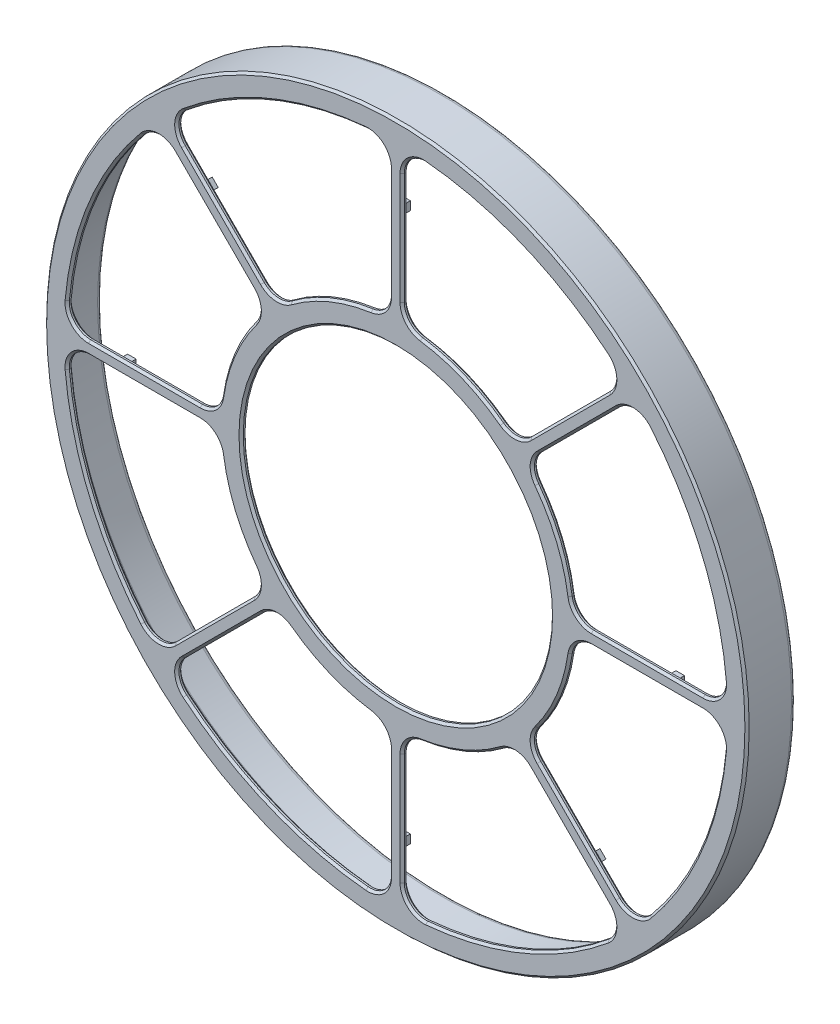
from build123d import *

# Parameters (mm, degrees)
SKETCH1_R           = 104.14
SKETCH1_R_2         = 45.847
BOSS_EXTRUDE5_DEPTH = 1.778
FILLET1_R           = 6.35
BOSS_EXTRUDE6_START = 12.7
SKETCH2_R           = 104.14
SKETCH2_R_2         = 101.6
BOSS_EXTRUDE6_DEPTH = 12.7
FILLET2_R           = 2.54
CHAMFER2_SIZE       = 0.635
SKETCH4_W           = 2.54
SKETCH4_H           = 2.54
BOSS_EXTRUDE7_DEPTH = 1.27
FILLET3_R           = 1.27


with BuildPart() as part:
    # Sketch1 → Boss-Extrude5 (new body)
    with BuildSketch(Plane.XY):
        Circle(SKETCH1_R)
        with BuildLine():
            ThreePointArc((-1.905, 52.162225643), (-19.974927119, 48.223739958), (-35.537225056, 38.231301892))
            Line((-35.537225056, 38.231301892), (-67.787811965, 70.481888801))
            ThreePointArc((-67.787811965, 70.481888801), (-37.422612851, 90.346179484), (-1.905, 97.771443044))
            Line((-1.905, 97.771443044), (-1.905, 52.162225643))
        make_face(mode=Mode.SUBTRACT)
        with BuildLine():
            Line((-70.481888801, 67.787811965), (-38.231301892, 35.537225056))
            ThreePointArc((-38.231301892, 35.537225056), (-48.223739958, 19.974927119), (-52.162225643, 1.905))
            Line((-52.162225643, 1.905), (-97.771443044, 1.905))
            ThreePointArc((-97.771443044, 1.905), (-90.346179484, 37.422612851), (-70.481888801, 67.787811965))
        make_face(mode=Mode.SUBTRACT)
        with BuildLine():
            Line((1.905, 52.162225643), (1.905, 97.771443044))
            ThreePointArc((1.905, 97.771443044), (37.422612851, 90.346179484), (67.787811965, 70.481888801))
            Line((67.787811965, 70.481888801), (35.537225056, 38.231301892))
            ThreePointArc((35.537225056, 38.231301892), (19.974927119, 48.223739958), (1.905, 52.162225643))
        make_face(mode=Mode.SUBTRACT)
        with BuildLine():
            Line((-97.771443044, -1.905), (-52.162225643, -1.905))
            ThreePointArc((-52.162225643, -1.905), (-48.223739958, -19.974927119), (-38.231301892, -35.537225056))
            Line((-38.231301892, -35.537225056), (-70.481888801, -67.787811965))
            ThreePointArc((-70.481888801, -67.787811965), (-90.346179484, -37.422612851), (-97.771443044, -1.905))
        make_face(mode=Mode.SUBTRACT)
        with BuildLine():
            Line((38.231301892, 35.537225056), (70.481888801, 67.787811965))
            ThreePointArc((70.481888801, 67.787811965), (90.346179484, 37.422612851), (97.771443044, 1.905))
            Line((97.771443044, 1.905), (52.162225643, 1.905))
            ThreePointArc((52.162225643, 1.905), (48.223739958, 19.974927119), (38.231301892, 35.537225056))
        make_face(mode=Mode.SUBTRACT)
        with BuildLine():
            Line((-67.787811965, -70.481888801), (-35.537225056, -38.231301892))
            ThreePointArc((-35.537225056, -38.231301892), (-19.974927119, -48.223739958), (-1.905, -52.162225643))
            Line((-1.905, -52.162225643), (-1.905, -97.771443044))
            ThreePointArc((-1.905, -97.771443044), (-37.422612851, -90.346179484), (-67.787811965, -70.481888801))
        make_face(mode=Mode.SUBTRACT)
        with BuildLine():
            Line((52.162225643, -1.905), (97.771443044, -1.905))
            ThreePointArc((97.771443044, -1.905), (90.346179484, -37.422612851), (70.481888801, -67.787811965))
            Line((70.481888801, -67.787811965), (38.231301892, -35.537225056))
            ThreePointArc((38.231301892, -35.537225056), (48.223739958, -19.974927119), (52.162225643, -1.905))
        make_face(mode=Mode.SUBTRACT)
        with BuildLine():
            Line((1.905, -97.771443044), (1.905, -52.162225643))
            ThreePointArc((1.905, -52.162225643), (19.974927119, -48.223739958), (35.537225056, -38.231301892))
            Line((35.537225056, -38.231301892), (67.787811965, -70.481888801))
            ThreePointArc((67.787811965, -70.481888801), (37.422612851, -90.346179484), (1.905, -97.771443044))
        make_face(mode=Mode.SUBTRACT)
        Circle(SKETCH1_R_2, mode=Mode.SUBTRACT)
    extrude(amount=BOSS_EXTRUDE5_DEPTH)

    # Fillet1
    fillet1_edges = [part.edges().sort_by_distance(p)[0] for p in [
        (-70.481888801, 67.787811965, 0.889),
        (-97.771443044, 1.905, 0.889),
        (-52.162225643, 1.905, 0.889),
        (-38.231301892, 35.537225056, 0.889),
        (-1.905, 97.771443044, 0.889),
        (-67.787811965, 70.481888801, 0.889),
        (-35.537225056, 38.231301892, 0.889),
        (-1.905, 52.162225643, 0.889),
        (67.787811965, 70.481888801, 0.889),
        (1.905, 97.771443044, 0.889),
        (1.905, 52.162225643, 0.889),
        (35.537225056, 38.231301892, 0.889),
        (97.771443044, 1.905, 0.889),
        (70.481888801, 67.787811965, 0.889),
        (38.231301892, 35.537225056, 0.889),
        (52.162225643, 1.905, 0.889),
        (70.481888801, -67.787811965, 0.889),
        (97.771443044, -1.905, 0.889),
        (52.162225643, -1.905, 0.889),
        (38.231301892, -35.537225056, 0.889),
        (1.905, -97.771443044, 0.889),
        (67.787811965, -70.481888801, 0.889),
        (35.537225056, -38.231301892, 0.889),
        (1.905, -52.162225643, 0.889),
        (-67.787811965, -70.481888801, 0.889),
        (-1.905, -97.771443044, 0.889),
        (-1.905, -52.162225643, 0.889),
        (-35.537225056, -38.231301892, 0.889),
        (-97.771443044, -1.905, 0.889),
        (-70.481888801, -67.787811965, 0.889),
        (-38.231301892, -35.537225056, 0.889),
        (-52.162225643, -1.905, 0.889),
    ]]
    fillet(fillet1_edges, radius=FILLET1_R)

    # Sketch2 → Boss-Extrude6 (add)
    with BuildSketch(Plane(origin=(0, 0, 0), x_dir=(-1, 0, 0), z_dir=(0, 0, -1)).offset(BOSS_EXTRUDE6_START)):
        Circle(SKETCH2_R)
        Circle(SKETCH2_R_2, mode=Mode.SUBTRACT)
    extrude(amount=-BOSS_EXTRUDE6_DEPTH)

    # Fillet2
    fillet2_edges = [part.edges().sort_by_distance(p)[0] for p in [
        (101.6, 0, 0),
    ]]
    fillet(fillet2_edges, radius=FILLET2_R)

    # Chamfer2
    chamfer2_edges = [part.edges().sort_by_distance(p)[0] for p in [
        (-19.974927119, 48.223739958, 0),
        (-19.974927119, 48.223739958, 1.778),
        (-1.905, 74.514363019, 0),
        (-1.905, 74.514363019, 1.778),
        (19.974927119, 48.223739958, 0),
        (19.974927119, 48.223739958, 1.778),
        (51.342572969, 54.036649805, 0),
        (51.342572969, 54.036649805, 1.778),
        (37.422612851, 90.346179484, 0),
        (37.422612851, 90.346179484, 1.778),
        (1.905, 74.514363019, 0),
        (1.905, 74.514363019, 1.778),
        (74.514363019, 1.905, 0),
        (74.514363019, 1.905, 1.778),
        (90.346179484, 37.422612851, 0),
        (90.346179484, 37.422612851, 1.778),
        (54.036649805, 51.342572969, 0),
        (54.036649805, 51.342572969, 1.778),
        (48.223739958, 19.974927119, 0),
        (48.223739958, 19.974927119, 1.778),
        (90.346179484, -37.422612851, 0),
        (90.346179484, -37.422612851, 1.778),
        (74.514363019, -1.905, 0),
        (74.514363019, -1.905, 1.778),
        (48.223739958, -19.974927119, 0),
        (48.223739958, -19.974927119, 1.778),
        (54.036649805, -51.342572969, 0),
        (54.036649805, -51.342572969, 1.778),
        (19.974927119, -48.223739958, 0),
        (19.974927119, -48.223739958, 1.778),
        (1.905, -74.514363019, 0),
        (1.905, -74.514363019, 1.778),
        (37.422612851, -90.346179484, 0),
        (37.422612851, -90.346179484, 1.778),
        (51.342572969, -54.036649805, 0),
        (51.342572969, -54.036649805, 1.778),
        (-1.905, -74.514363019, 0),
        (-1.905, -74.514363019, 1.778),
        (-104.14, 0, 1.778),
        (-19.974927119, -48.223739958, 0),
        (-19.974927119, -48.223739958, 1.778),
        (-37.422612851, -90.346179484, 0),
        (-37.422612851, -90.346179484, 1.778),
        (-51.342572969, -54.036649805, 0),
        (-45.847, 0, 1.778),
        (-51.342572969, -54.036649805, 1.778),
        (-54.036649805, -51.342572969, 0),
        (-54.036649805, -51.342572969, 1.778),
        (-48.223739958, -19.974927119, 0),
        (-48.223739958, -19.974927119, 1.778),
        (-90.346179484, -37.422612851, 0),
        (-90.346179484, -37.422612851, 1.778),
        (-74.514363019, -1.905, 0),
        (-74.514363019, -1.905, 1.778),
        (-90.346179484, 37.422612851, 0),
        (-90.346179484, 37.422612851, 1.778),
        (-74.514363019, 1.905, 0),
        (-74.514363019, 1.905, 1.778),
        (-48.223739958, 19.974927119, 0),
        (-48.223739958, 19.974927119, 1.778),
        (-54.036649805, 51.342572969, 0),
        (-54.036649805, 51.342572969, 1.778),
        (-37.422612851, 90.346179484, 0),
        (-37.422612851, 90.346179484, 1.778),
        (-51.342572969, 54.036649805, 0),
        (-51.342572969, 54.036649805, 1.778),
        (-3.458757459, 53.800552801, 0),
        (-3.458757459, 53.800552801, 1.778),
        (35.597024864, 40.488446571, 0),
        (35.597024864, 40.488446571, 1.778),
        (64.900169662, 70.51791329, 0),
        (64.900169662, 70.51791329, 1.778),
        (3.972344614, 95.755044751, 0),
        (3.972344614, 95.755044751, 1.778),
        (95.755044751, 3.972344614, 0),
        (95.755044751, 3.972344614, 1.778),
        (70.51791329, 64.900169662, 0),
        (70.51791329, 64.900169662, 1.778),
        (40.488446571, 35.597024864, 0),
        (40.488446571, 35.597024864, 1.778),
        (53.800552801, 3.458757459, 0),
        (53.800552801, 3.458757459, 1.778),
        (95.755044751, -3.972344614, 0),
        (95.755044751, -3.972344614, 1.778),
        (53.800552801, -3.458757459, 0),
        (53.800552801, -3.458757459, 1.778),
        (40.488446571, -35.597024864, 0),
        (40.488446571, -35.597024864, 1.778),
        (70.51791329, -64.900169662, 0),
        (70.51791329, -64.900169662, 1.778),
        (3.458757459, -53.800552801, 0),
        (3.458757459, -53.800552801, 1.778),
        (3.972344614, -95.755044751, 0),
        (3.972344614, -95.755044751, 1.778),
        (64.900169662, -70.51791329, 0),
        (64.900169662, -70.51791329, 1.778),
        (35.597024864, -40.488446571, 0),
        (35.597024864, -40.488446571, 1.778),
        (-3.458757459, -53.800552801, 0),
        (-3.458757459, -53.800552801, 1.778),
        (-3.972344614, -95.755044751, 0),
        (-3.972344614, -95.755044751, 1.778),
        (-35.597024864, -40.488446571, 0),
        (-35.597024864, -40.488446571, 1.778),
        (-64.900169662, -70.51791329, 0),
        (-64.900169662, -70.51791329, 1.778),
        (-40.488446571, -35.597024864, 0),
        (-40.488446571, -35.597024864, 1.778),
        (-70.51791329, -64.900169662, 0),
        (-70.51791329, -64.900169662, 1.778),
        (-53.800552801, -3.458757459, 0),
        (-53.800552801, -3.458757459, 1.778),
        (-95.755044751, -3.972344614, 0),
        (-95.755044751, -3.972344614, 1.778),
        (-95.755044751, 3.972344614, 0),
        (-95.755044751, 3.972344614, 1.778),
        (-53.800552801, 3.458757459, 0),
        (-53.800552801, 3.458757459, 1.778),
        (-70.51791329, 64.900169662, 0),
        (-70.51791329, 64.900169662, 1.778),
        (-40.488446571, 35.597024864, 0),
        (-40.488446571, 35.597024864, 1.778),
        (-3.972344614, 95.755044751, 0),
        (-3.972344614, 95.755044751, 1.778),
        (-64.900169662, 70.51791329, 0),
        (-64.900169662, 70.51791329, 1.778),
        (3.458757459, 53.800552801, 0),
        (3.458757459, 53.800552801, 1.778),
        (-35.597024864, 40.488446571, 0),
        (-35.597024864, 40.488446571, 1.778),
        (-45.847, 0, 0),
    ]]
    chamfer(chamfer2_edges, length=CHAMFER2_SIZE)

    # Sketch4 → Boss-Extrude7 (add)
    with BuildSketch(Plane(origin=(0, 0, 0), x_dir=(-1, 0, 0), z_dir=(0, 0, -1))):
        with Locations((0, 81.28)):
            Rectangle(SKETCH4_W, SKETCH4_H)
        Polygon((57.473639175, 59.269690399), (55.677587951, 57.473639175), (57.473639175, 55.677587951), (59.269690399, 57.473639175), align=None)
        with Locations((81.28, 0)):
            Rectangle(SKETCH4_W, SKETCH4_H)
        Polygon((59.269690399, -57.473639175), (57.473639175, -55.677587951), (55.677587951, -57.473639175), (57.473639175, -59.269690399), align=None)
        with Locations((0, -81.28)):
            Rectangle(SKETCH4_W, SKETCH4_H)
        Polygon((-57.473639175, -59.269690399), (-55.677587951, -57.473639175), (-57.473639175, -55.677587951), (-59.269690399, -57.473639175), align=None)
        with Locations((-81.28, 0)):
            Rectangle(SKETCH4_W, SKETCH4_H)
        Polygon((-59.269690399, 57.473639175), (-57.473639175, 55.677587951), (-55.677587951, 57.473639175), (-57.473639175, 59.269690399), align=None)
    extrude(amount=BOSS_EXTRUDE7_DEPTH)

    # Fillet3
    fillet3_edges = [part.edges().sort_by_distance(p)[0] for p in [
        (104.14, 0, -12.7),
        (101.6, 0, -12.7),
    ]]
    fillet(fillet3_edges, radius=FILLET3_R - 0.0001)  # a hair under: the kernel refuses the full size


solid = part.part
